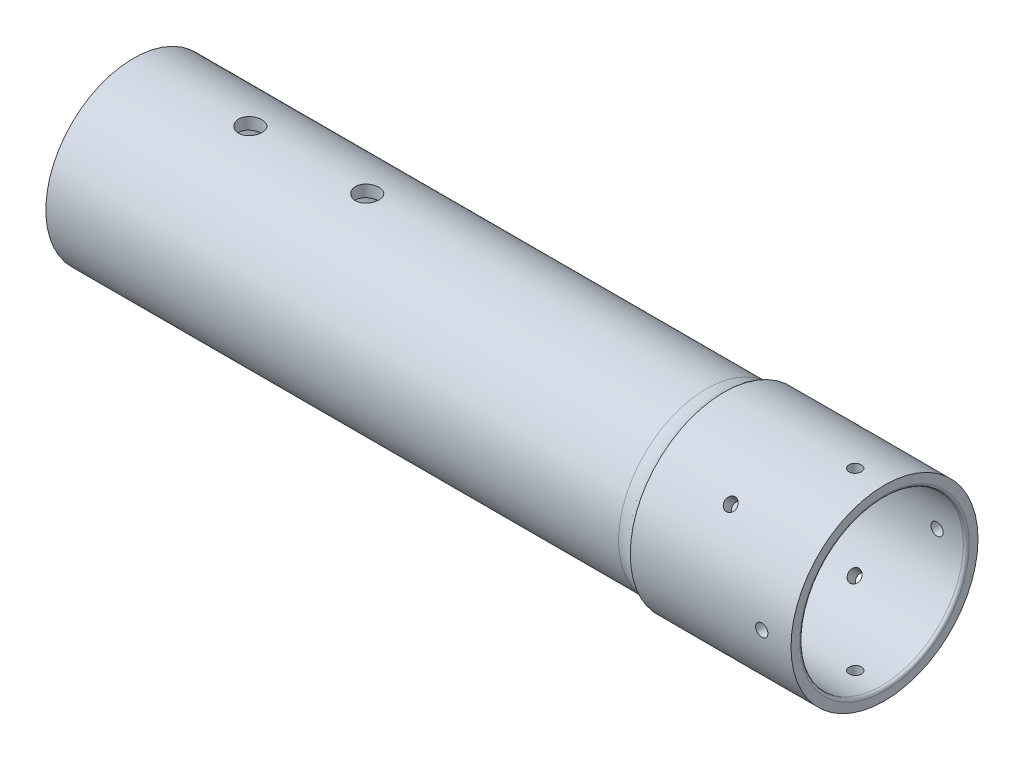
from build123d import *

# Parameters (mm, degrees)
SKETCH_1_R               = 30
SKETCH_1_R_2             = 26
EXTRUDE_1_DEPTH          = 257
EXTRUDE_THIN1_START      = -55
SKETCH2_R                = 32
SKETCH2_R_2              = 30
EXTRUDE_THIN1_DEPTH      = 55
SKETCH_2_R               = 4
CUT_EXTRUDE_1_DEPTH      = 261.954018938
CUT_EXTRUDE_2_REACH      = 262.954
CUT_EXTRUDE_2_END_RADIUS = 32
SKETCH_3_R               = 2.1
CUT_EXTRUDE_3_REACH      = 262.954
CUT_EXTRUDE_3_END_RADIUS = 32
SKETCH_4_R               = 2.1
PATTERN_CIRCULAR_1_COUNT = 4
CUT_EXTRUDE1_START       = -43
SKETCH1_R                = 28
SKETCH1_R_2              = 26
CUT_EXTRUDE1_DEPTH       = 43
FILLET1_R                = 1
FILLET2_R                = 10
FILLET3_R                = 1


with BuildPart() as part:
    # Эскиз1 → Бобышка-Вытянуть1 (new body)
    with BuildSketch(Plane(origin=(0, 0, 0), x_dir=(0, 0, -1), z_dir=(1, 0, 0))):
        Circle(SKETCH_1_R)
        Circle(SKETCH_1_R_2, mode=Mode.SUBTRACT)
    extrude(amount=EXTRUDE_1_DEPTH)

    # Sketch2 → Extrude-Thin1 (add)
    with BuildSketch(Plane(origin=(257, 0, 0), x_dir=(0, 0, -1), z_dir=(1, 0, 0)).offset(EXTRUDE_THIN1_START)):
        Circle(SKETCH2_R)
        Circle(SKETCH2_R_2, mode=Mode.SUBTRACT)
    extrude(amount=EXTRUDE_THIN1_DEPTH)

    # Эскиз2 → Вырез-Вытянуть1 (cut, through all)
    with BuildSketch(Plane(origin=(0, 0, 0), x_dir=(1, 0, 0), z_dir=(0, 1, 0))):
        with Locations(Location((40, 0, 0), (0, 0, 90))):
            Circle(SKETCH_2_R)
        with Locations(Location((80, 0, 0), (0, 0, 90))):
            Circle(SKETCH_2_R)
    extrude(amount=CUT_EXTRUDE_1_DEPTH, mode=Mode.SUBTRACT)

    # Вырез-Вытянуть2: up to this cylinder (the profile starts inside it)
    cut_extrude_2_end = Plane(origin=(247, 0, 0), z_dir=(1, 0, 0)) * Cylinder(CUT_EXTRUDE_2_END_RADIUS, 590.908, mode=Mode.PRIVATE)
    # Эскиз3 → Вырез-Вытянуть2 (cut, up to the surface)
    with BuildSketch(Plane(origin=(0, 0, 0), x_dir=(1, 0, 0), z_dir=(0, 1, 0)), mode=Mode.PRIVATE) as cut_extrude_2_sk1:
        with Locations(Location((247, 0, 0), (0, 0, 90))):
            Circle(SKETCH_3_R)
    cut_extrude_2_tool1 = extrude(cut_extrude_2_sk1.sketch, amount=CUT_EXTRUDE_2_REACH, mode=Mode.PRIVATE) & cut_extrude_2_end
    cut_extrude_2 = cut_extrude_2_tool1.solids().sort_by_distance((247, 0, 0))[0]
    add(cut_extrude_2, mode=Mode.SUBTRACT)

    # Вырез-Вытянуть3: up to this cylinder (the profile starts inside it)
    cut_extrude_3_end = Plane(origin=(227, 0, 0), z_dir=(1, 0, 0)) * Cylinder(CUT_EXTRUDE_3_END_RADIUS, 590.908, mode=Mode.PRIVATE)
    # Эскиз4 → Вырез-Вытянуть3 (cut, up to the surface)
    with BuildSketch(Plane(origin=(0, 0, 0), x_dir=(-1, 0, 0), z_dir=(0, 0.7071067811865464, -0.7071067811865488)), mode=Mode.PRIVATE) as cut_extrude_3_sk1:
        with Locations(Location((-227, 0, 0), (0, 0, 270))):
            Circle(SKETCH_4_R)
    cut_extrude_3_tool1 = extrude(cut_extrude_3_sk1.sketch, amount=CUT_EXTRUDE_3_REACH, mode=Mode.PRIVATE) & cut_extrude_3_end
    cut_extrude_3 = cut_extrude_3_tool1.solids().sort_by_distance((227, 0, 0))[0]
    add(cut_extrude_3, mode=Mode.SUBTRACT)

    # Круговой массив1: Вырез-Вытянуть2, Вырез-Вытянуть3 ×4 about axis
    pattern_circular_1_axis = Axis((257, 0, 0), (-1, 0, 0))
    add([cut_extrude_2.rotate(pattern_circular_1_axis, i * 360 / PATTERN_CIRCULAR_1_COUNT) for i in range(1, PATTERN_CIRCULAR_1_COUNT)], mode=Mode.SUBTRACT)
    add([cut_extrude_3.rotate(pattern_circular_1_axis, i * 360 / PATTERN_CIRCULAR_1_COUNT) for i in range(1, PATTERN_CIRCULAR_1_COUNT)], mode=Mode.SUBTRACT)

    # Sketch1 → Cut-Extrude1 (cut)
    with BuildSketch(Plane(origin=(257, 0, 0), x_dir=(0, 0, -1), z_dir=(1, 0, 0)).offset(CUT_EXTRUDE1_START)):
        Circle(SKETCH1_R)
        Circle(SKETCH1_R_2, mode=Mode.SUBTRACT)
    extrude(amount=CUT_EXTRUDE1_DEPTH, mode=Mode.SUBTRACT)

    # Fillet1
    fillet1_edges = [part.edges().sort_by_distance(p)[0] for p in [
        (214, 0, 28),
    ]]
    fillet(fillet1_edges, radius=FILLET1_R)

    # Fillet2
    # the kernel refuses this fillet: 10 mm, written as the material it adds along each edge
    with BuildSketch(Plane(origin=(202, 0, 0), x_dir=(0, 0, -1), z_dir=(0, -1, 0))) as fillet2_piece_1:
        with BuildLine():
            CenterArc((40, -6), FILLET2_R, 143.130102354, 36.869897646)
            Line((32, 0), (31.84, 0.12))
            ThreePointArc((31.84, 0.12), (31, 0.2), (30, 0.2))
            Line((30, 0.2), (29.8, 0))
            Line((29.8, 0), (29.8, -6))
            Line((29.8, -6), (30, -6))
        make_face()
    revolve(axis=Axis((202, 0, 0), (1, 0, 0)))

    # Fillet3
    fillet3_edges = [part.edges().sort_by_distance(p)[0] for p in [
        (257, 0, 28),
    ]]
    fillet(fillet3_edges, radius=FILLET3_R)


solid = part.part
